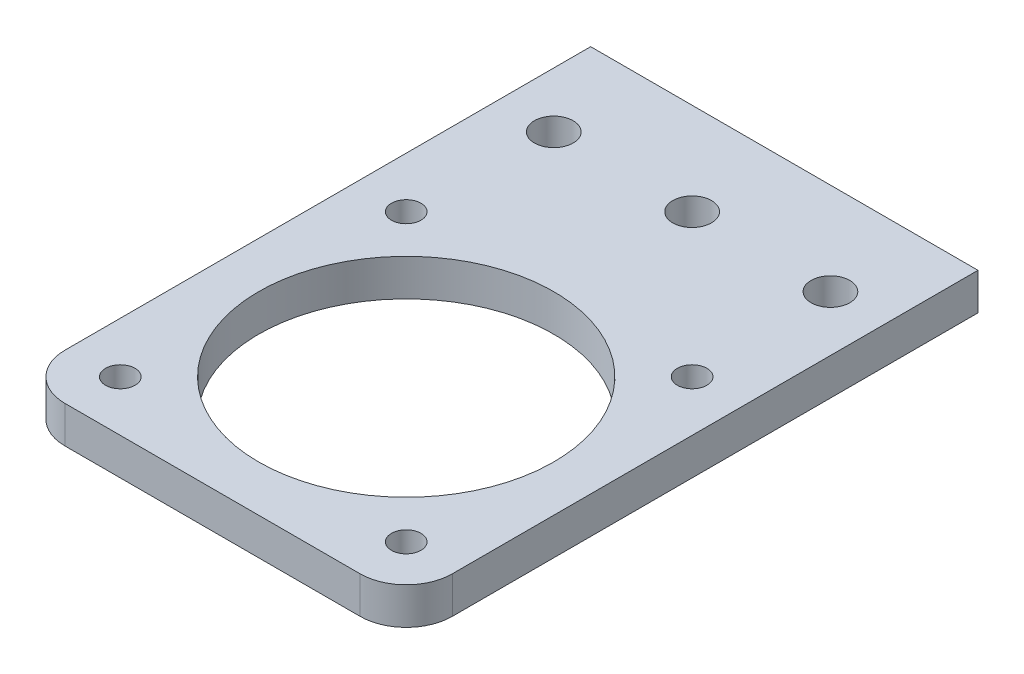
from build123d import *

# Parameters (mm, degrees)
SKETCH_1_R      = 1.6
SKETCH_1_R_2    = 16
SKETCH_1_R_3    = 2.1
EXTRUDE_1_DEPTH = 4


with BuildPart() as part:
    # 草图1 → 凸台-拉伸1 (new body)
    with BuildSketch(Plane(origin=(0, 0, 0), x_dir=(1, 0, 0), z_dir=(0, 1, 0))):
        with BuildLine():
            Line((0, 0), (42, 0))
            Line((42, 0), (42, -57))
            ThreePointArc((42, -57), (40.535533906, -60.535533906), (37, -62))
            Line((37, -62), (5, -62))
            ThreePointArc((5, -62), (1.464466094, -60.535533906), (0, -57))
            Line((0, -57), (0, 0))
        make_face()
        with Locations((5.5, -25.5)):
            Circle(SKETCH_1_R, mode=Mode.SUBTRACT)
        with Locations((36.5, -25.5)):
            Circle(SKETCH_1_R, mode=Mode.SUBTRACT)
        with Locations((36.5, -56.5)):
            Circle(SKETCH_1_R, mode=Mode.SUBTRACT)
        with Locations((5.5, -56.5)):
            Circle(SKETCH_1_R, mode=Mode.SUBTRACT)
        with Locations((21, -41)):
            Circle(SKETCH_1_R_2, mode=Mode.SUBTRACT)
        with Locations((21, -10)):
            Circle(SKETCH_1_R_3, mode=Mode.SUBTRACT)
        with Locations((36, -10)):
            Circle(SKETCH_1_R_3, mode=Mode.SUBTRACT)
        with Locations((6, -10)):
            Circle(SKETCH_1_R_3, mode=Mode.SUBTRACT)
    extrude(amount=EXTRUDE_1_DEPTH)


solid = part.part
